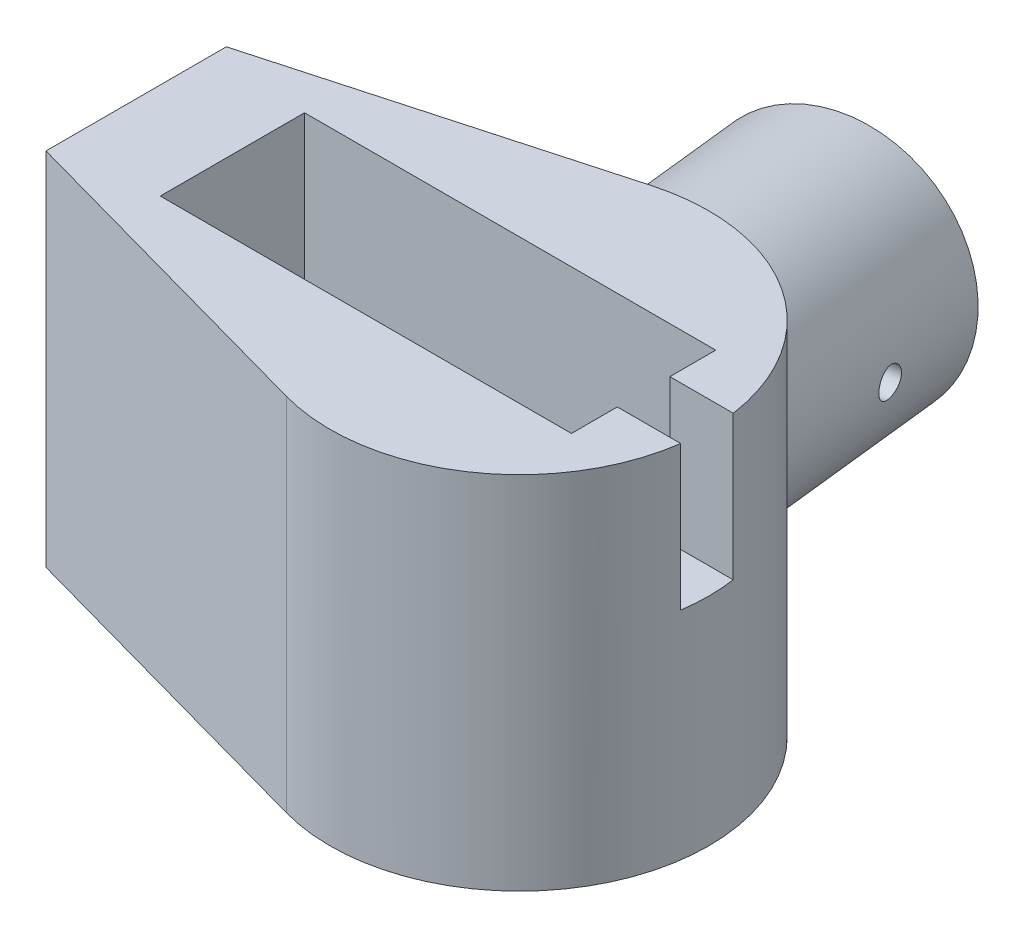
from build123d import *

# Parameters (mm, degrees)
BOSS_EXTRUDE1_DEPTH       = 40
REVOLVE1_START            = -44.95139953
REVOLVE1_OUTLINE_R        = 13.5
REVOLVE1_DEPTH            = 30.829897511
M18_CLEARANCE_HOLE1_D     = 20
M18_CLEARANCE_HOLE1_DEPTH = 25
SKETCH9_W                 = 1.6
SKETCH9_H                 = 27
CUT_EXTRUDE4_DEPTH        = 76.299241718
CUT_EXTRUDE4_DEPTH_BACK   = 76.299241718
SKETCH18_R                = 1.6
SCALE2_SCALE              = 1.25
SKETCH19_W                = 57
SKETCH19_H                = 20
CUT_EXTRUDE5_DEPTH        = 39
SKETCH20_W                = 40
SKETCH20_H                = 20
CUT_EXTRUDE6_DEPTH        = 10
SKETCH21_R                = 5.5
CUT_EXTRUDE7_DEPTH        = 96.0605556
SKETCH22_W                = 7.783449774
SKETCH22_H                = 2
SKETCH22_W_2              = 10.366550226
CUT_EXTRUDE8_DEPTH        = 2
SKETCH23_W                = 9.71853625
SKETCH23_H                = 7.281011564
CUT_EXTRUDE9_DEPTH        = 20
SKETCH25_W                = 2.5
SKETCH25_H                = 9
BOSS_EXTRUDE3_DEPTH       = 10
SKETCH26_W                = 2.5
SKETCH26_H                = 2
BOSS_EXTRUDE4_DEPTH       = 8
SKETCH27_R                = 2.1
CUT_EXTRUDE10_DEPTH       = 8


with BuildPart() as part:
    # Sketch1 → Boss-Extrude1 (new body)
    with BuildSketch(Plane(origin=(0, 40, 0), x_dir=(1, 0, 0), z_dir=(0, 1, 0))):
        with BuildLine():
            Line((-5.61521172, 20.235350191), (-42.5, 10))
            Line((-42.5, 10), (-42.5, -10))
            Line((-42.5, -10), (-5.61521172, -20.235350191))
            ThreePointArc((-5.61521172, -20.235350191), (21, 0), (-5.61521172, 20.235350191))
        make_face()
    extrude(amount=-BOSS_EXTRUDE1_DEPTH)

    # Revolve1: read off the stored shape, not the designer's step
    # Revolve1 outline → Revolve1 (add)
    with BuildSketch(Plane(origin=(0, 0, 0), x_dir=(0.9799247046208294, -0.02083962380947531, -0.19827577601224947), z_dir=(0.19936793441719802, 0.10243002349202102, 0.9745565745577031)).offset(REVOLVE1_START)):
        with Locations((-1.9070974, 22.005607966)):
            Circle(REVOLVE1_OUTLINE_R)
    extrude(amount=REVOLVE1_DEPTH)

    # M18 Clearance Hole1
    with Locations(Plane(origin=(-8.961867673, -4.60437291, -43.807681948), x_dir=(-0.9799247046208296, 0.02083962380947534, 0.19827577601224922), z_dir=(-0.19936793441719777, -0.10243002349202121, -0.9745565745577032))):
        with Locations((1.9070974, 22.005607966)):
            Hole(M18_CLEARANCE_HOLE1_D / 2, depth=M18_CLEARANCE_HOLE1_DEPTH)

    # Sketch9 → M3.5 Clearance Hole1 (revolve, cut)
    with BuildSketch(Plane(origin=(-18.009225855, 18.806465846, -31.591069121), x_dir=(-0.12392681772022805, 0.7153744254872676, -0.6876638533531477), z_dir=(0.1561720753640579, 0.6984304843277114, 0.6984304843277114))):
        with Locations((0.8, 13.5)):
            Rectangle(SKETCH9_W, SKETCH9_H)
    revolve(axis=Axis((-11.78670398, 18.674134235, -32.850120299), (-0.9799247046208297, 0.020839623809475325, 0.19827577601224802)), mode=Mode.SUBTRACT)

    # Sketch18 → Cut-Extrude4 (cut, two sides: drawn at the far end of the back side and taken through both)
    with BuildSketch(Plane(origin=(-1.740210315, 0.03700828, 0.352110268), x_dir=(-0.19823095447813932, 0.004215689735382395, -0.9801462730872066), z_dir=(0.9799247046208297, -0.020839623809475356, -0.19827577601224802)).offset(-CUT_EXTRUDE4_DEPTH_BACK)):
        with Locations(Location((34.613136918, 18.419306886, 0), (0, 0, 359.758405588))):
            Circle(SKETCH18_R)
    extrude(amount=CUT_EXTRUDE4_DEPTH + CUT_EXTRUDE4_DEPTH_BACK, mode=Mode.SUBTRACT)


with BuildPart() as part_1:
    # Scale2: scaled about (0, 0, 0)
    add(part.part.scale(SCALE2_SCALE))

    # Sketch19 → Cut-Extrude5 (cut)
    with BuildSketch(Plane(origin=(0, 50, 0), x_dir=(1, 0, 0), z_dir=(0, 1, 0))):
        with Locations((-11.2875, 0)):
            Rectangle(SKETCH19_W, SKETCH19_H)
    extrude(amount=-CUT_EXTRUDE5_DEPTH, mode=Mode.SUBTRACT)

    # Sketch20 → Cut-Extrude6 (cut)
    with BuildSketch(Plane(origin=(0, 11, 0), x_dir=(1, 0, 0), z_dir=(0, 1, 0))):
        with Locations((-13.154050226, 0)):
            Rectangle(SKETCH20_W, SKETCH20_H)
    extrude(amount=-CUT_EXTRUDE6_DEPTH, mode=Mode.SUBTRACT)

    # Sketch21 → Cut-Extrude7 (cut, through all)
    with BuildSketch(Plane.XZ):
        with Locations(Location((0, 0, 0), (0, 0, 270))):
            Circle(SKETCH21_R)
    extrude(amount=-CUT_EXTRUDE7_DEPTH, mode=Mode.SUBTRACT)

    # Sketch22 → Cut-Extrude8 (cut)
    with BuildSketch(Plane(origin=(0, 11, 0), x_dir=(1, 0, 0), z_dir=(0, 1, 0))):
        with Locations((-37.045775113, 0)):
            Rectangle(SKETCH22_W, SKETCH22_H)
        with Locations((12.029224887, 0)):
            Rectangle(SKETCH22_W_2, SKETCH22_H)
    extrude(amount=-CUT_EXTRUDE8_DEPTH, mode=Mode.SUBTRACT)

    # Sketch23 → Cut-Extrude9 (cut)
    with BuildSketch(Plane(origin=(0, 50, 0), x_dir=(1, 0, 0), z_dir=(0, 1, 0))):
        with Locations((22.071768125, 0)):
            Rectangle(SKETCH23_W, SKETCH23_H)
    extrude(amount=-CUT_EXTRUDE9_DEPTH, mode=Mode.SUBTRACT)

    # Sketch25 → Boss-Extrude3 (add)
    with BuildSketch(Plane(origin=(0, 1, 0), x_dir=(1, 0, 0), z_dir=(0, 1, 0))):
        with Locations((-31.904050226, 5.5)):
            Rectangle(SKETCH25_W, SKETCH25_H)
        with Locations((-31.904050226, -5.5)):
            Rectangle(SKETCH25_W, SKETCH25_H)
    extrude(amount=BOSS_EXTRUDE3_DEPTH)

    # Sketch26 → Boss-Extrude4 (add)
    with BuildSketch(Plane(origin=(0, 1, 0), x_dir=(1, 0, 0), z_dir=(0, 1, 0))):
        with Locations((-31.904050226, 0)):
            Rectangle(SKETCH26_W, SKETCH26_H)
    extrude(amount=BOSS_EXTRUDE4_DEPTH)

    # Sketch27 → Cut-Extrude10 (cut)
    with BuildSketch(Plane(origin=(0, 11, 0), x_dir=(1, 0, 0), z_dir=(0, 1, 0))):
        with Locations(Location((14.75, 4.85, 0), (0, 0, 270))):
            Circle(SKETCH27_R)
        with Locations(Location((14.75, -4.85, 0), (0, 0, 270))):
            Circle(SKETCH27_R)
        with Locations(Location((-34.75, 4.85, 0), (0, 0, 270))):
            Circle(SKETCH27_R)
        with Locations(Location((-34.75, -4.85, 0), (0, 0, 270))):
            Circle(SKETCH27_R)
    extrude(amount=-CUT_EXTRUDE10_DEPTH, mode=Mode.SUBTRACT)


solid = part_1.part
